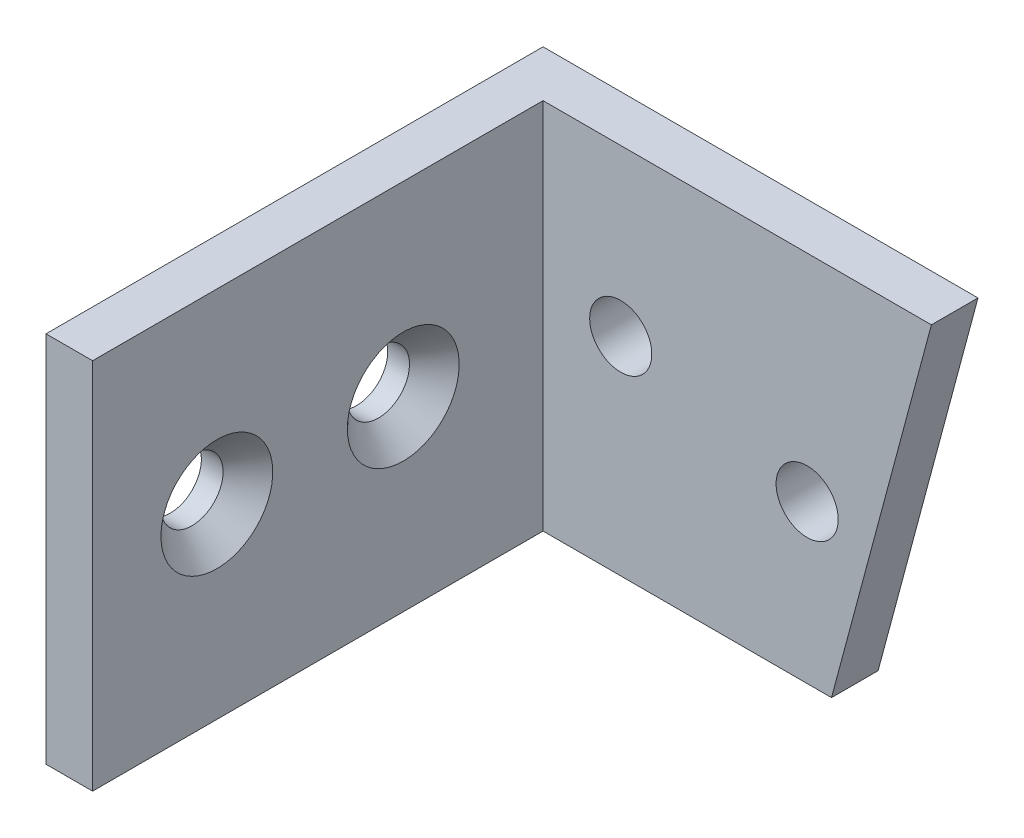
from build123d import *

# Parameters (mm, degrees)
BOSS_EXTRUDE1_DEPTH     = 38.1
CUT_EXTRUDE1_REACH      = 79.512
SKETCH2_R               = 3.175
CUT_EXTRUDE2_REACH      = 79.512
SKETCH4_R               = 3.175
CUT_EXTRUDE3_DEPTH      = 78.51162816
CUT_EXTRUDE3_DEPTH_BACK = 78.51162816
CHAMFER1_SIZE           = 2.54


with BuildPart() as part:
    # Sketch1 → Boss-Extrude1 (new body)
    with BuildSketch(Plane(origin=(0, 0, 0), x_dir=(1, 0, 0), z_dir=(0, 1, 0))):
        Polygon((0, 0), (0, 50.8), (44.45, 50.8), (44.45, 46.0375), (4.7625, 46.0375), (4.7625, 0), align=None)
    extrude(amount=BOSS_EXTRUDE1_DEPTH)

    # Sketch2 → Cut-Extrude1 (cut, up to next)
    with BuildSketch(Plane(origin=(0, 0, -50.8), x_dir=(-1, 0, 0), z_dir=(0, 0, -1)), mode=Mode.PRIVATE) as cut_extrude1_sk1:
        with Locations((-12.7, 21.20738686)):
            Circle(SKETCH2_R)
    cut_extrude1_tool1 = extrude(cut_extrude1_sk1.sketch, amount=-CUT_EXTRUDE1_REACH, mode=Mode.PRIVATE) & part.part
    # Sketch2 → Cut-Extrude1 (cut, up to next)
    with BuildSketch(Plane(origin=(0, 0, -50.8), x_dir=(-1, 0, 0), z_dir=(0, 0, -1)), mode=Mode.PRIVATE) as cut_extrude1_sk2:
        with Locations((-31.75, 16.102954744)):
            Circle(SKETCH2_R)
    cut_extrude1_tool2 = extrude(cut_extrude1_sk2.sketch, amount=-CUT_EXTRUDE1_REACH, mode=Mode.PRIVATE) & part.part
    add(cut_extrude1_tool1.solids().sort_by_distance((12.7, 21.207387, -50.8))[0], mode=Mode.SUBTRACT)
    add(cut_extrude1_tool2.solids().sort_by_distance((31.75, 16.102955, -50.8))[0], mode=Mode.SUBTRACT)

    # Sketch4 → Cut-Extrude2 (cut, up to next)
    with BuildSketch(Plane.ZY, mode=Mode.PRIVATE) as cut_extrude2_sk1:
        with Locations((-12.7, 19.05)):
            Circle(SKETCH4_R)
    cut_extrude2_tool1 = extrude(cut_extrude2_sk1.sketch, amount=-CUT_EXTRUDE2_REACH, mode=Mode.PRIVATE) & part.part
    # Sketch4 → Cut-Extrude2 (cut, up to next)
    with BuildSketch(Plane.ZY, mode=Mode.PRIVATE) as cut_extrude2_sk2:
        with Locations((-31.75, 19.05)):
            Circle(SKETCH4_R)
    cut_extrude2_tool2 = extrude(cut_extrude2_sk2.sketch, amount=-CUT_EXTRUDE2_REACH, mode=Mode.PRIVATE) & part.part
    add(cut_extrude2_tool1.solids().sort_by_distance((0, 19.05, -12.7))[0], mode=Mode.SUBTRACT)
    add(cut_extrude2_tool2.solids().sort_by_distance((0, 19.05, -31.75))[0], mode=Mode.SUBTRACT)

    # Sketch5 → Cut-Extrude3 (cut, two sides: drawn at the far end of the back side and taken through both)
    with BuildSketch(Plane(origin=(0, 0, -50.8), x_dir=(-1, 0, 0), z_dir=(0, 0, -1)).offset(-CUT_EXTRUDE3_DEPTH_BACK)):
        Polygon((-1.34828542, -122.757788706), (-34.241135768, 0), (-44.45, 38.1), (-77.342850349, 160.857788706), (-322.858427761, 95.072088009), (-246.863862833, -188.543489404), align=None)
    extrude(amount=CUT_EXTRUDE3_DEPTH + CUT_EXTRUDE3_DEPTH_BACK, mode=Mode.SUBTRACT)

    # Chamfer1
    chamfer1_edges = [part.edges().sort_by_distance(p)[0] for p in [
        (4.7625, 19.05, -15.875),
        (4.7625, 19.05, -34.925),
    ]]
    chamfer(chamfer1_edges, length=CHAMFER1_SIZE)


solid = part.part
